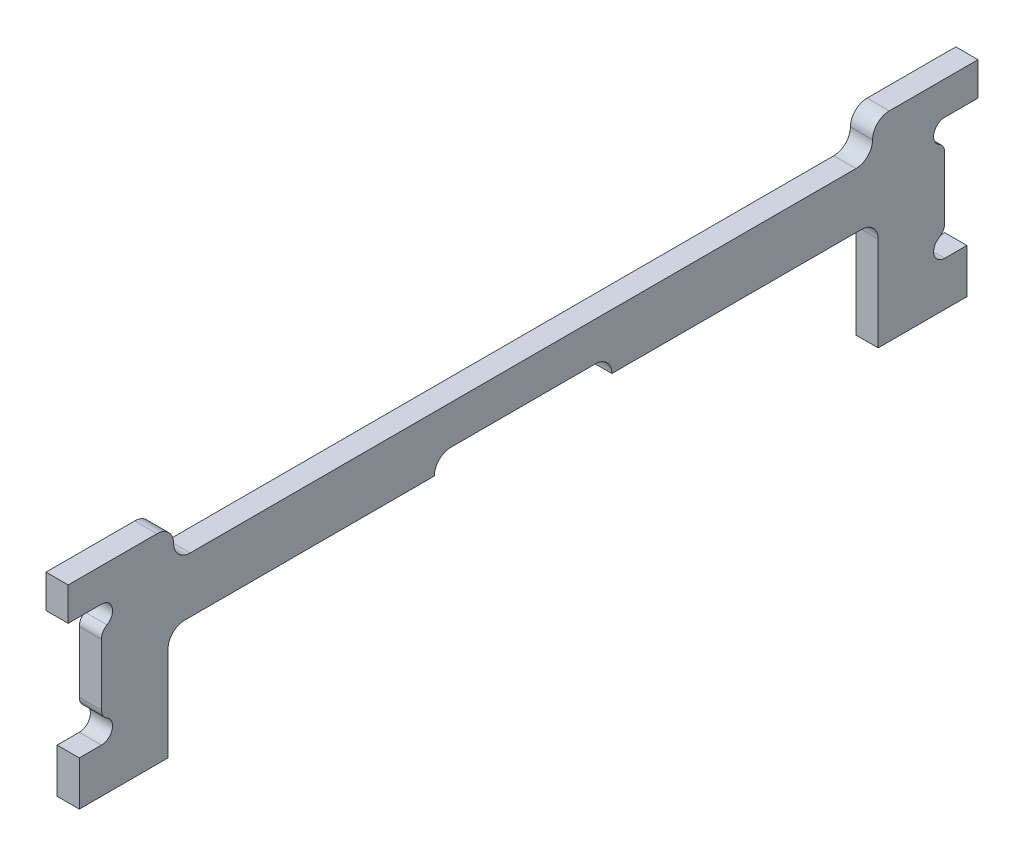
from build123d import *

# Parameters (mm, degrees)
EXTRUDE_1_DEPTH     = 2
SKETCH_3_W          = 2
SKETCH_3_H          = 4
EXTRUDE_2_DEPTH     = 2
SKETCH_4_W          = 16
SKETCH_4_H          = 3
CUT_EXTRUDE_1_DEPTH = 10
FILLET_1_R          = 1.5
SKETCH_5_R          = 1
CUT_EXTRUDE_2_DEPTH = 10
FILLET_2_R          = 1
FILLET_3_R          = 1.5


# Some blends are built 0.0001 mm under size
with BuildPart() as part:
    # 草图1 → 凸台-拉伸1 (new body)
    with BuildSketch(Plane(origin=(0, 0, 0), x_dir=(0, 0, -1), z_dir=(1, 0, 0))):
        Polygon((32, -10), (32, 0), (0, 0), (0, 5), (31.5, 5), (31.5, 8), (41, 8), (41, 5), (38, 5), (38, -10), align=None)
    extrude_1 = extrude(amount=EXTRUDE_1_DEPTH)

    # 草图3 → 凸台-拉伸2 (add)
    with BuildSketch(Plane(origin=(2, 0, 0), x_dir=(0, 0, -1), z_dir=(1, 0, 0))):
        with Locations((39, -8)):
            Rectangle(SKETCH_3_W, SKETCH_3_H)
    extrude_2 = extrude(amount=-EXTRUDE_2_DEPTH)

    # 镜向1: 凸台-拉伸1, 凸台-拉伸2 across plane
    add(extrude_1.mirror(Plane.XY))
    add(extrude_2.mirror(Plane.XY))

    # 草图4 → 切除-拉伸1 (cut)
    with BuildSketch(Plane(origin=(2, 0, 0), x_dir=(0, 0, -1), z_dir=(1, 0, 0))):
        Rectangle(SKETCH_4_W, SKETCH_4_H)
    extrude(amount=-CUT_EXTRUDE_1_DEPTH, mode=Mode.SUBTRACT)

    # 圆角1
    fillet_1_edges = [part.edges().sort_by_distance(p)[0] for p in [
        (1, 1.5, -8),
        (1, 1.5, 8),
    ]]
    fillet(fillet_1_edges, radius=FILLET_1_R - 0.0001)  # a hair under: the kernel refuses the full size

    # 草图5 → 切除-拉伸2 (cut)
    with BuildSketch(Plane(origin=(2, 0, 0), x_dir=(0, 0, -1), z_dir=(1, 0, 0))):
        with Locations((-38, 4)):
            Circle(SKETCH_5_R)
        with Locations((-38, -5)):
            Circle(SKETCH_5_R)
        with Locations((38, -5)):
            Circle(SKETCH_5_R)
        with Locations((38, 4)):
            Circle(SKETCH_5_R)
    extrude(amount=-CUT_EXTRUDE_2_DEPTH, mode=Mode.SUBTRACT)

    # 圆角2
    fillet_2_edges = [part.edges().sort_by_distance(p)[0] for p in [
        (1, 3, -38),
        (1, -4, -38),
        (1, -4, 38),
        (1, 3, 38),
    ]]
    fillet(fillet_2_edges, radius=FILLET_2_R)

    # 圆角3
    # the kernel refuses this fillet: 1.5 mm, written as the material it adds along each edge
    with BuildSketch(Plane(origin=(0, 0, 32), x_dir=(0, -1, 0), z_dir=(1, 0, 0)), Plane(origin=(0, 0, -32), x_dir=(0, 0, 1), z_dir=(1, 0, 0))) as fillet_3_piece_1:
        with BuildLine():
            CenterArc((FILLET_3_R, FILLET_3_R), FILLET_3_R, 180, 90)
            Line((0, FILLET_3_R), (0, 0))
            Line((0, 0), (FILLET_3_R, 0))
        make_face()
    extrude(amount=2)
    with BuildSketch(Plane(origin=(0, 5, -31.5), x_dir=(0, 0, 1), z_dir=(1, 0, 0)), Plane(origin=(0, 5, 31.5), x_dir=(0, 1, 0), z_dir=(1, 0, 0))) as fillet_3_piece_2:
        with BuildLine():
            CenterArc((FILLET_3_R, -FILLET_3_R), FILLET_3_R, 90, 90)
            Line((0, -FILLET_3_R), (0, 0))
            Line((0, 0), (FILLET_3_R, 0))
        make_face()
    extrude(amount=2)
    # the kernel refuses this fillet: 1.5 mm, written as the material it takes off along each edge
    with BuildSketch(Plane(origin=(-3.75, 8, -31.5), x_dir=(0, -1, 0), z_dir=(1, 0, 0)), Plane(origin=(-3.75, 8, 31.5), x_dir=(0, 0, 1), z_dir=(1, 0, 0))) as fillet_3_2_piece_1:
        with BuildLine():
            CenterArc((FILLET_3_R, FILLET_3_R), FILLET_3_R, 180, 90)
            Line((0, FILLET_3_R), (0, 0))
            Line((0, 0), (FILLET_3_R, 0))
        make_face()
    extrude(amount=9.5, mode=Mode.SUBTRACT)


solid = part.part
